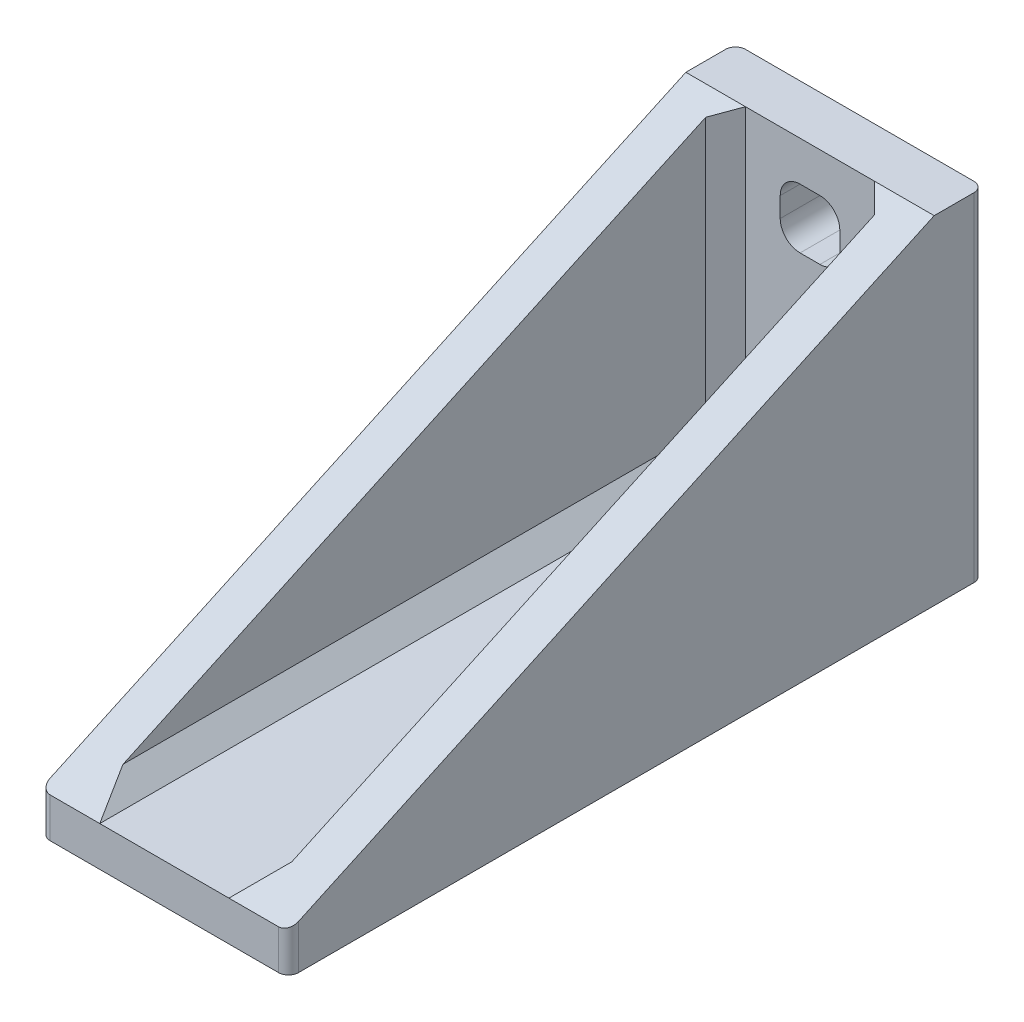
from build123d import *

# Parameters (mm, degrees)
ESBO_O1_W               = 25
ESBO_O1_H               = 70
BASE_DEPTH              = 4
ESBO_O2_W               = 25
ESBO_O2_H               = 5
PAREDE_DO_FUNDO_DEPTH   = 30
PAREDES_START           = -12.5
PAREDES_LATERAIS_DEPTH  = 25
ESBO_O3_W               = 17
ESBO_O3_H               = 30
CORTE_NAS_PAREDES_DEPTH = 65
CHANFRO3_SIZE           = 2
CHANFRO4_SIZE           = 2
CHANFRO5_SIZE           = 2
CHANFRO6_SIZE           = 2
CHANFRO7_SIZE           = 2
PARAFUSO_DEPTH          = 45
FILETE1_R               = 1
FILETE2_R               = 1
FILETE3_R               = 1
FILETE4_R               = 1


with BuildPart() as part:
    # Esboço1 → Base (new body)
    with BuildSketch(Plane(origin=(0, 0, 0), x_dir=(1, 0, 0), z_dir=(0, 1, 0))):
        Rectangle(ESBO_O1_W, ESBO_O1_H)
    extrude(amount=BASE_DEPTH)

    # Esboço2 → Parede do fundo (add)
    with BuildSketch(Plane(origin=(0, 4, 0), x_dir=(1, 0, 0), z_dir=(0, 1, 0))):
        with Locations((0, 32.5)):
            Rectangle(ESBO_O2_W, ESBO_O2_H)
    extrude(amount=PAREDE_DO_FUNDO_DEPTH)

    # Paredes Laterais: read off the stored shape, not the designer's step
    # Paredes Laterais outline → Paredes Laterais (add)
    with BuildSketch(Plane.YZ.offset(PAREDES_START)):
        Polygon((34, -30), (4, 35), (4, -30), align=None)
    extrude(amount=PAREDES_LATERAIS_DEPTH)

    # Esboço3 → Corte nas Paredes (cut)
    with BuildSketch(Plane.XY.offset(35)):
        with Locations((0, 19)):
            Rectangle(ESBO_O3_W, ESBO_O3_H)
    extrude(amount=-CORTE_NAS_PAREDES_DEPTH, mode=Mode.SUBTRACT)

    # Chanfro3
    chanfro3_edges = [part.edges().sort_by_distance(p)[0] for p in [
        (-8.5, 4, 2.5),
    ]]
    chamfer(chanfro3_edges, length=CHANFRO3_SIZE)

    # Chanfro4
    chanfro4_edges = [part.edges().sort_by_distance(p)[0] for p in [
        (8.5, 4, 2.5),
    ]]
    chamfer(chanfro4_edges, length=CHANFRO4_SIZE)

    # Chanfro5
    chanfro5_edges = [part.edges().sort_by_distance(p)[0] for p in [
        (0, 4, -30),
    ]]
    chamfer(chanfro5_edges, length=CHANFRO5_SIZE)

    # Chanfro6
    chanfro6_edges = [part.edges().sort_by_distance(p)[0] for p in [
        (-8.5, 20, -30),
    ]]
    chamfer(chanfro6_edges, length=CHANFRO6_SIZE)

    # Chanfro7
    chanfro7_edges = [part.edges().sort_by_distance(p)[0] for p in [
        (8.5, 20, -30),
    ]]
    chamfer(chanfro7_edges, length=CHANFRO7_SIZE)

    # Esboço4 → Parafuso (cut)
    with BuildSketch(Plane(origin=(0, 0, -35), x_dir=(-1, 0, 0), z_dir=(0, 0, -1))):
        with BuildLine():
            Line((-1, 16), (1, 16))
            ThreePointArc((1, 16), (2.414213562, 15.414213562), (3, 14))
            Line((3, 14), (3, 12))
            ThreePointArc((3, 12), (2.414213562, 10.585786438), (1, 10))
            Line((1, 10), (-1, 10))
            ThreePointArc((-1, 10), (-2.414213562, 10.585786438), (-3, 12))
            Line((-3, 12), (-3, 14))
            ThreePointArc((-3, 14), (-2.414213562, 15.414213562), (-1, 16))
        make_face()
        with BuildLine():
            Line((-3, 26), (-3, 28))
            ThreePointArc((-3, 28), (-2.414213562, 29.414213562), (-1, 30))
            Line((-1, 30), (1, 30))
            ThreePointArc((1, 30), (2.414213562, 29.414213562), (3, 28))
            Line((3, 28), (3, 26))
            ThreePointArc((3, 26), (2.414213562, 24.585786438), (1, 24))
            Line((1, 24), (-1, 24))
            ThreePointArc((-1, 24), (-2.414213562, 24.585786438), (-3, 26))
        make_face()
    extrude(amount=-PARAFUSO_DEPTH, mode=Mode.SUBTRACT)

    # Filete1
    filete1_edges = [part.edges().sort_by_distance(p)[0] for p in [
        (12.5, 17, -35),
    ]]
    fillet(filete1_edges, radius=FILETE1_R)

    # Filete2
    filete2_edges = [part.edges().sort_by_distance(p)[0] for p in [
        (-12.5, 17, -35),
    ]]
    fillet(filete2_edges, radius=FILETE2_R)

    # Filete3
    filete3_edges = [part.edges().sort_by_distance(p)[0] for p in [
        (12.5, 2, 35),
    ]]
    fillet(filete3_edges, radius=FILETE3_R)

    # Filete4
    filete4_edges = [part.edges().sort_by_distance(p)[0] for p in [
        (-12.5, 2, 35),
    ]]
    fillet(filete4_edges, radius=FILETE4_R)


solid = part.part
